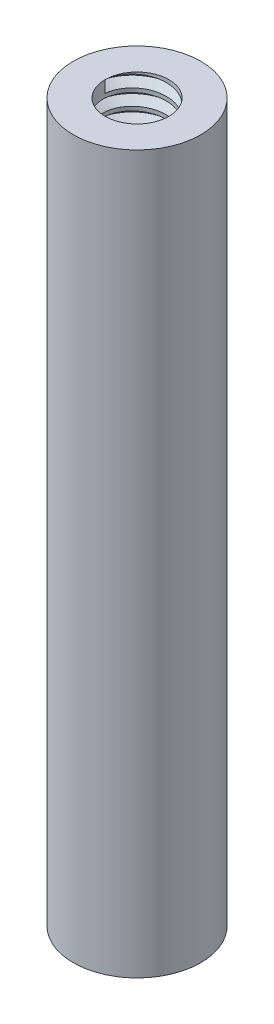
from build123d import *
from build123d.topology import SkipClean

# Parameters (mm, degrees)
SKETCH1_R           = 3.175
BOSS_EXTRUDE1_DEPTH = 35.7251
SKETCH3_R           = 1.5875
CUT_EXTRUDE1_DEPTH  = 6.35
CUT_EXTRUDE2_START  = -6.35
SKETCH4_R           = 1.5875
CUT_EXTRUDE2_DEPTH  = 6.35
THREAD1_PITCH       = 0.79375
THREAD2_PITCH       = 0.79375


with BuildPart() as part:
    # Sketch1 → Boss-Extrude1 (new body)
    with BuildSketch(Plane(origin=(0, 0, 0), x_dir=(1, 0, 0), z_dir=(0, 1, 0))):
        with Locations(Location((0, 0, 0), (0, 0, 90))):
            Circle(SKETCH1_R)
    extrude(amount=BOSS_EXTRUDE1_DEPTH)

    # Sketch3 → Cut-Extrude1 (cut)
    with BuildSketch(Plane(origin=(0, 35.7251, 0), x_dir=(1, 0, 0), z_dir=(0, 1, 0))):
        with Locations(Location((0, 0, 0), (0, 0, 270))):
            Circle(SKETCH3_R)
    extrude(amount=-CUT_EXTRUDE1_DEPTH, mode=Mode.SUBTRACT)

    # Sketch4 → Cut-Extrude2 (cut)
    with BuildSketch(Plane.XZ.offset(CUT_EXTRUDE2_START)):
        with Locations(Location((0, 0, 0), (0, 0, 90))):
            Circle(SKETCH4_R)
    extrude(amount=CUT_EXTRUDE2_DEPTH, mode=Mode.SUBTRACT)

    # Thread1: the profile of Thread Profile2 profile screwed along a right-hand helix of 8 turns, 8 arcs to a turn; built about Z, then put on its axis
    thread1_z = Axis((0, 0, 0), (0, 0, 1))
    thread1_corners = [(1.5872, 0, -0.000173205), (2.017129788, 0, 0.248046874), (2.017129788, 0, 0.347265624), (1.5872, 0, 0.595485703)]
    with BuildLine(mode=Mode.PRIVATE) as thread1_profile:
        Line(thread1_corners[0], thread1_corners[1])
        Line(thread1_corners[1], thread1_corners[2])
        Line(thread1_corners[2], thread1_corners[3])
        Line(thread1_corners[3], thread1_corners[0])
    thread1_cap = Face(thread1_profile.wire())
    thread1_turn_angles = [0, 22.5, 45, 67.5, 90, 112.5, 135, 157.5, 180, 202.5, 225, 247.5, 270, 292.5, 315, 337.5, 360]
    thread1_turn_weights = [1, 0.9238795325112867, 1, 0.9238795325112867, 1, 0.9238795325112867, 1, 0.9238795325112867, 1, 0.9238795325112867, 1, 0.9238795325112867, 1, 0.9238795325112867, 1, 0.9238795325112867, 1]
    thread1_turn_rails = [Edge.make_bspline([Vector(p[0], p[1], 0).rotate(thread1_z, thread1_turn_angles[k]) / thread1_turn_weights[k] + Vector(0, 0, p[2] + THREAD1_PITCH * thread1_turn_angles[k] / 360) for k in range(17)], [0, 0, 0, 1, 1, 2, 2, 3, 3, 4, 4, 5, 5, 6, 6, 7, 7, 8, 8, 8], 2, thread1_turn_weights) for p in thread1_corners]
    thread1_turn_sides = [Face.make_surface_from_curves(thread1_turn_rails[p[0]], thread1_turn_rails[p[1]]) for p in [(0, 1), (1, 2), (2, 3), (3, 0)]]
    thread1 = Plane(origin=(0, 0, 0), x_dir=(1, 0, 0), z_dir=(0, 1, 0)) * Solid(Shell([*[p.moved(Location((0, 0, THREAD1_PITCH * i))) for i in range(8) for p in thread1_turn_sides], thread1_cap, thread1_cap.rotate(thread1_z, 2880).moved(Location((0, 0, THREAD1_PITCH * 2880 / 360)))]))
    add(thread1, mode=Mode.SUBTRACT)

    # Thread2: the profile of Thread Profile3 profile screwed along a right-hand helix of 8 turns, 8 arcs to a turn; built about Z, then put on its axis
    with SkipClean():  # the faces are left unmerged after this step: merging them gives an invalid solid
        thread2_z = Axis((0, 0, 0), (0, 0, 1))
        thread2_corners = [(1.5872, 0, -0.000173205), (2.017129788, 0, 0.248046874), (2.017129788, 0, 0.347265624), (1.5872, 0, 0.595485703)]
        with BuildLine(mode=Mode.PRIVATE) as thread2_profile:
            Line(thread2_corners[0], thread2_corners[1])
            Line(thread2_corners[1], thread2_corners[2])
            Line(thread2_corners[2], thread2_corners[3])
            Line(thread2_corners[3], thread2_corners[0])
        thread2_cap = Face(thread2_profile.wire())
        thread2_turn_angles = [0, 22.5, 45, 67.5, 90, 112.5, 135, 157.5, 180, 202.5, 225, 247.5, 270, 292.5, 315, 337.5, 360]
        thread2_turn_weights = [1, 0.9238795325112867, 1, 0.9238795325112867, 1, 0.9238795325112867, 1, 0.9238795325112867, 1, 0.9238795325112867, 1, 0.9238795325112867, 1, 0.9238795325112867, 1, 0.9238795325112867, 1]
        thread2_turn_rails = [Edge.make_bspline([Vector(p[0], p[1], 0).rotate(thread2_z, thread2_turn_angles[k]) / thread2_turn_weights[k] + Vector(0, 0, p[2] + THREAD2_PITCH * thread2_turn_angles[k] / 360) for k in range(17)], [0, 0, 0, 1, 1, 2, 2, 3, 3, 4, 4, 5, 5, 6, 6, 7, 7, 8, 8, 8], 2, thread2_turn_weights) for p in thread2_corners]
        thread2_turn_sides = [Face.make_surface_from_curves(thread2_turn_rails[p[0]], thread2_turn_rails[p[1]]) for p in [(0, 1), (1, 2), (2, 3), (3, 0)]]
        thread2 = Plane(origin=(0, 35.7251, 0), x_dir=(-1, 0, 0), z_dir=(0, -1, 0)) * Solid(Shell([*[p.moved(Location((0, 0, THREAD2_PITCH * i))) for i in range(8) for p in thread2_turn_sides], thread2_cap, thread2_cap.rotate(thread2_z, 2880).moved(Location((0, 0, THREAD2_PITCH * 2880 / 360)))]))
        add(thread2, mode=Mode.SUBTRACT)


solid = part.part
